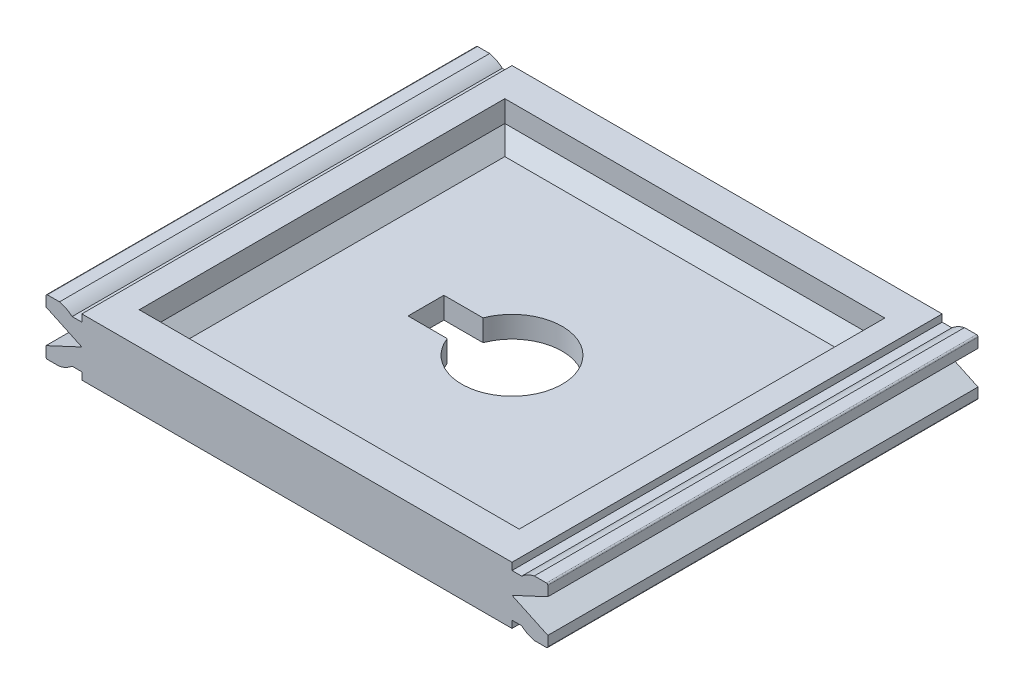
from build123d import *

# Parameters (mm, degrees)
EXTRUDE_1_DEPTH       = 2
EXTRUDE_1_DEPTH_BACK  = 2
SKETCH_1_W            = 30
SKETCH_1_H            = 30
SKETCH_2_W            = 26.5
SKETCH_2_H            = 25.5
CUT_EXTRUDE_1_DEPTH   = 2.5
CHAMFER_1_SIZE        = 1
EXTRUDE_2_DEPTH       = 15
MIRROR_2_COPY_1_DEPTH = 15
FILLET_1_R            = 0.1
CUT_EXTRUDE_2_REACH   = 25.184


with BuildPart() as part:
    # 草图1 → 凸台-拉伸1 (new, two sides: drawn at the far end of the back side and taken through both)
    with BuildSketch(Plane(origin=(0, 0, 0), x_dir=(1, 0, 0), z_dir=(0, 1, 0)).offset(-EXTRUDE_1_DEPTH_BACK)):
        Rectangle(SKETCH_1_W, SKETCH_1_H)
    extrude(amount=EXTRUDE_1_DEPTH + EXTRUDE_1_DEPTH_BACK)

    # 草图2 → 切除-拉伸1 (cut)
    with BuildSketch(Plane(origin=(0, 2, 0), x_dir=(1, 0, 0), z_dir=(0, 1, 0))):
        Rectangle(SKETCH_2_W, SKETCH_2_H)
    extrude(amount=-CUT_EXTRUDE_1_DEPTH, mode=Mode.SUBTRACT)

    # 倒角1
    chamfer_1_edges = [part.edges().sort_by_distance(p)[0] for p in [
        (13.25, -0.5, 0),
        (0, -0.5, 12.75),
        (-13.25, -0.5, 0),
        (0, -0.5, -12.75),
    ]]
    chamfer(chamfer_1_edges, length=CHAMFER_1_SIZE)

    # 草图3 → 凸台-拉伸2 (add, symmetric)
    with BuildSketch(Plane.XY):
        with BuildLine():
            Line((15.677124344, 1.5), (15, 1.5))
            Line((15, 1.5), (15, 0))
            Line((15, 0), (17.5, 1.165769145))
            Line((17.5, 1.165769145), (17.5, 1.95))
            Line((17.5, 1.95), (16.555590279, 1.95))
            ThreePointArc((16.555590279, 1.95), (16.088161527, 1.780042303), (15.677124344, 1.5))
        make_face()
    extrude_2 = extrude(amount=EXTRUDE_2_DEPTH, both=True)

    # 镜向1: 凸台-拉伸2 across plane
    add(extrude_2.mirror(Plane.ZX))

    # 镜向2: 凸台-拉伸2 across plane
    add(extrude_2.mirror(Plane(origin=(0, 0, 0), x_dir=(0, 0, 1), z_dir=(1, 0, 0))))

    # 镜向2 copy 1 sketch → 镜向2 copy 1 (add, symmetric)
    with BuildSketch(Plane(origin=(0, 0, 0), x_dir=(-1, 0, 0), z_dir=(0, 0, 1))):
        with BuildLine():
            Line((15.677124344, 1.5), (15, 1.5))
            Line((15, 1.5), (15, 0))
            Line((15, 0), (17.5, 1.165769145))
            Line((17.5, 1.165769145), (17.5, 1.95))
            Line((17.5, 1.95), (16.555590279, 1.95))
            ThreePointArc((16.555590279, 1.95), (16.088161527, 1.780042303), (15.677124344, 1.5))
        make_face()
    extrude(amount=MIRROR_2_COPY_1_DEPTH, both=True)

    # 圆角1
    fillet_1_edges = [part.edges().sort_by_distance(p)[0] for p in [
        (17.5, -1.95, 0),
        (17.5, 1.95, 0),
        (-17.5, -1.95, 0),
        (-17.5, 1.95, 0),
    ]]
    fillet(fillet_1_edges, radius=FILLET_1_R)

    # 草图4 → 切除-拉伸2 (cut, up to next)
    with BuildSketch(Plane(origin=(0, -0.5, 0), x_dir=(1, 0, 0), z_dir=(0, 1, 0)), mode=Mode.PRIVATE) as cut_extrude_2_sk1:
        with BuildLine():
            Line((-3.269174208, 1.25), (-6, 1.25))
            Line((-6, 1.25), (-6, -1.25))
            Line((-6, -1.25), (-3.269174208, -1.25))
            ThreePointArc((-3.269174208, -1.25), (3.5, 0), (-3.269174208, 1.25))
        make_face()
    cut_extrude_2_tool1 = extrude(cut_extrude_2_sk1.sketch, amount=-CUT_EXTRUDE_2_REACH, mode=Mode.PRIVATE) & part.part
    add(cut_extrude_2_tool1.solids().sort_by_distance((-0.675327, -0.5, 0))[0], mode=Mode.SUBTRACT)


solid = part.part
